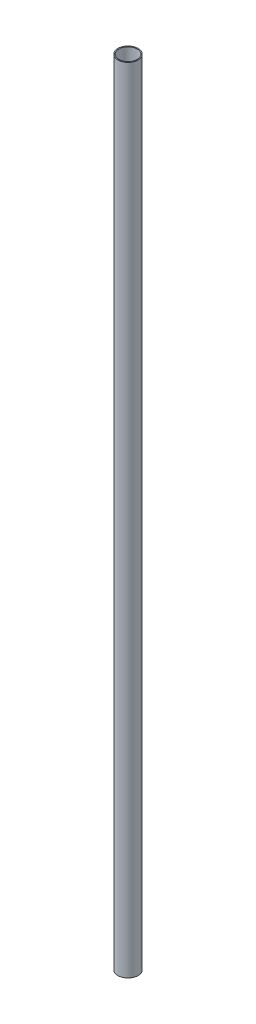
from build123d import *

# Parameters (mm, degrees)
SKETCH1_R           = 12.7
SKETCH1_R_2         = 11.5
BOSS_EXTRUDE1_DEPTH = 1000


with BuildPart() as part:
    # Sketch1 → Boss-Extrude1 (new body)
    with BuildSketch(Plane(origin=(0, 0, 0), x_dir=(1, 0, 0), z_dir=(0, 1, 0))):
        Circle(SKETCH1_R)
        Circle(SKETCH1_R_2, mode=Mode.SUBTRACT)
    extrude(amount=BOSS_EXTRUDE1_DEPTH)


solid = part.part
